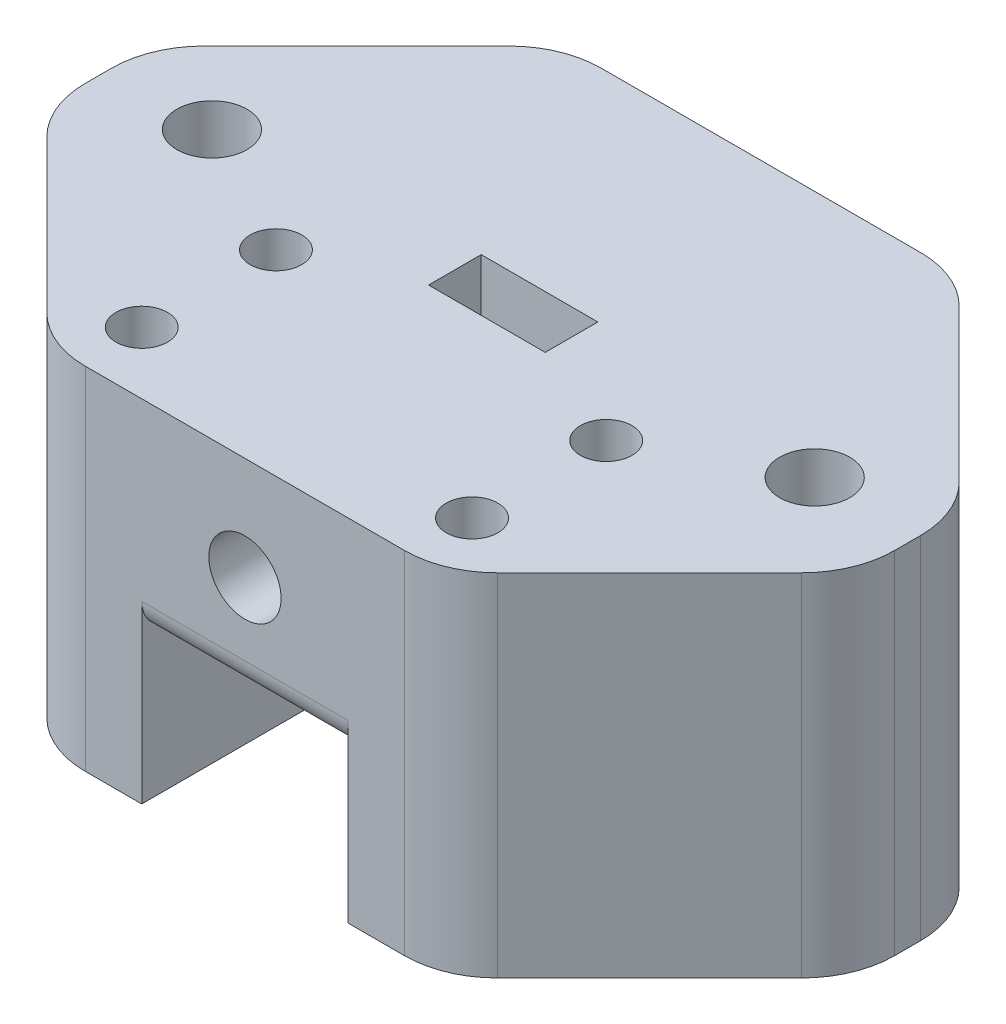
from build123d import *

# Parameters (mm, degrees)
SKETCH1_W                      = 39.2
SKETCH1_H                      = 25
BOSS_EXTRUDE1_DEPTH            = 10
F_3_5_3_5_DIAMETER_HOLE1_D     = 3.5
SKETCH9_W                      = 14.6
SKETCH9_H                      = 25
BOSS_EXTRUDE2_DEPTH            = 7
SKETCH10_W                     = 5.65
SKETCH10_H                     = 2.55
CUT_EXTRUDE4_DEPTH             = 10
F_2_5_2_5_DIAMETER_HOLE1_D     = 2.5
F_2_5_2_5_DIAMETER_HOLE1_DEPTH = 7
F_2_5_2_5_DIAMETER_HOLE1_TIP   = 0.751075774
F_3_4_3_4_DIAMETER_HOLE1_D     = 3.4
CHAMFER1_SIZE                  = 10
FILLET5_R                      = 4.5
FILLET6_R                      = 1.5
F_3_4_3_4_DIAMETER_HOLE2_D     = 3.4
F_3_4_3_4_DIAMETER_HOLE2_DEPTH = 4
F_3_4_3_4_DIAMETER_HOLE2_TIP   = 1.021463052


with BuildPart() as part:
    # Sketch1 → Boss-Extrude1 (new body)
    with BuildSketch(Plane(origin=(0, 0, 0), x_dir=(1, 0, 0), z_dir=(0, 1, 0))):
        with Locations((19.6, 12.5)):
            Rectangle(SKETCH1_W, SKETCH1_H)
    extrude(amount=BOSS_EXTRUDE1_DEPTH)

    # Ø3.5 (3.5) Diameter Hole1 (through all)
    with Locations(Plane(origin=(0, 0, -25), x_dir=(-1, 0, 0), z_dir=(0, 0, -1))):
        with Locations((-19.6, 5)):
            Hole(F_3_5_3_5_DIAMETER_HOLE1_D / 2)

    # Sketch9 → Boss-Extrude2 (add)
    with BuildSketch(Plane.XZ):
        with Locations((31.9, -12.5)):
            Rectangle(SKETCH9_W, SKETCH9_H)
        with Locations((7.3, -12.5)):
            Rectangle(SKETCH9_W, SKETCH9_H)
    extrude(amount=BOSS_EXTRUDE2_DEPTH)

    # Sketch10 → Cut-Extrude4 (cut)
    with BuildSketch(Plane(origin=(0, 10, 0), x_dir=(1, 0, 0), z_dir=(0, 1, 0))):
        with Locations((19.6, 12.995)):
            Rectangle(SKETCH10_W, SKETCH10_H)
    extrude(amount=-CUT_EXTRUDE4_DEPTH, mode=Mode.SUBTRACT)

    # Ø2.5 (2.5) Diameter Hole1
    with Locations(Plane(origin=(0, 10, 0), x_dir=(1, 0, 0), z_dir=(0, 1, 0))):
        with Locations((11.6, 3), (27.6, 3), (27.6, 9.5), (11.6, 9.5)):
            Hole(F_2_5_2_5_DIAMETER_HOLE1_D / 2, depth=F_2_5_2_5_DIAMETER_HOLE1_DEPTH)
            with Locations((0, 0, -(F_2_5_2_5_DIAMETER_HOLE1_DEPTH + F_2_5_2_5_DIAMETER_HOLE1_TIP / 2))):  # 118° drill point
                Cone(0, F_2_5_2_5_DIAMETER_HOLE1_D / 2, F_2_5_2_5_DIAMETER_HOLE1_TIP, mode=Mode.SUBTRACT)

    # Ø3.4 (3.4) Diameter Hole1 (through all)
    with Locations(Plane(origin=(0, 10, 0), x_dir=(1, 0, 0), z_dir=(0, 1, 0))):
        with Locations((34.2, 13), (5, 13)):
            Hole(F_3_4_3_4_DIAMETER_HOLE1_D / 2)

    # Chamfer1
    chamfer1_edges = [part.edges().sort_by_distance(p)[0] for p in [
        (0, 1.5, -25),
        (0, 1.5, 0),
        (39.2, 1.5, 0),
        (39.2, 1.5, -25),
    ]]
    chamfer(chamfer1_edges, length=CHAMFER1_SIZE)

    # Fillet5
    fillet5_edges = [part.edges().sort_by_distance(p)[0] for p in [
        (29.2, 1.5, 0),
        (10, 1.5, 0),
        (0, 1.5, -10),
        (0, 1.5, -15),
        (10, 1.5, -25),
        (29.2, 1.5, -25),
        (39.2, 1.5, -10),
        (39.2, 1.5, -15),
    ]]
    fillet(fillet5_edges, radius=FILLET5_R)

    # Fillet6
    fillet6_edges = [part.edges().sort_by_distance(p)[0] for p in [
        (19.6, 0, 0),
    ]]
    fillet(fillet6_edges, radius=FILLET6_R)

    # Ø3.4 (3.4) Diameter Hole2
    with Locations(Plane(origin=(0, -7, 0), x_dir=(-1, 0, 0), z_dir=(0, -1, 0))):
        with Locations((-9.6, 13), (-29.6, 13)):
            Hole(F_3_4_3_4_DIAMETER_HOLE2_D / 2, depth=F_3_4_3_4_DIAMETER_HOLE2_DEPTH)
            with Locations((0, 0, -(F_3_4_3_4_DIAMETER_HOLE2_DEPTH + F_3_4_3_4_DIAMETER_HOLE2_TIP / 2))):  # 118° drill point
                Cone(0, F_3_4_3_4_DIAMETER_HOLE2_D / 2, F_3_4_3_4_DIAMETER_HOLE2_TIP, mode=Mode.SUBTRACT)


solid = part.part
